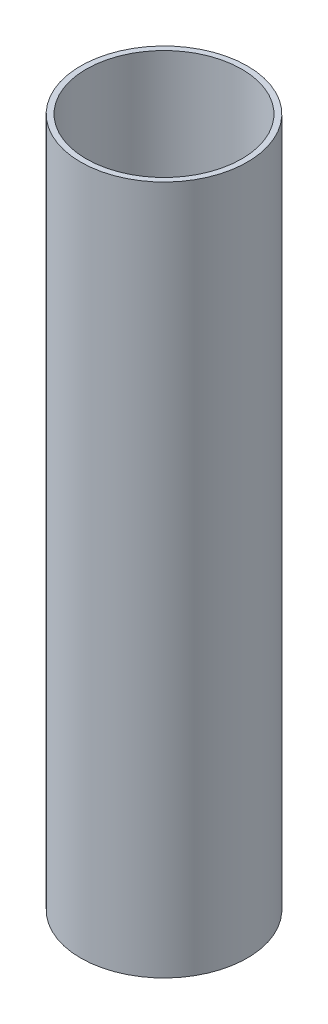
from build123d import *

# Parameters (mm, degrees)
SKETCH1_R           = 37.5
SKETCH1_R_2         = 35
BOSS_EXTRUDE1_DEPTH = 310.2


with BuildPart() as part:
    # Sketch1 → Boss-Extrude1 (new body)
    with BuildSketch(Plane(origin=(0, 0, 0), x_dir=(1, 0, 0), z_dir=(0, 1, 0))):
        Circle(SKETCH1_R)
        Circle(SKETCH1_R_2, mode=Mode.SUBTRACT)
    extrude(amount=BOSS_EXTRUDE1_DEPTH)


solid = part.part
